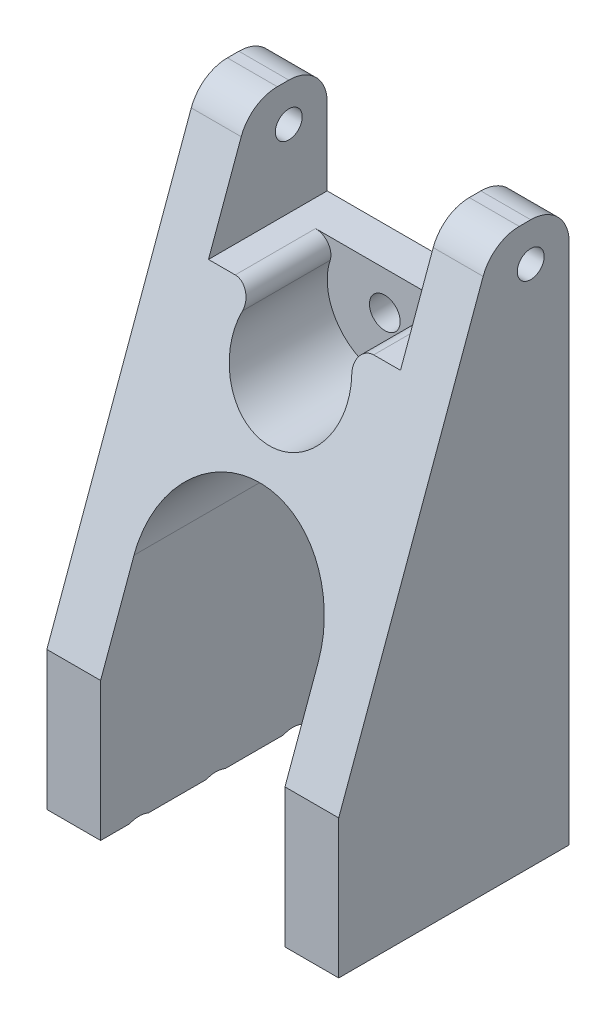
from build123d import *

# Parameters (mm, degrees)
BOSS_EXTRUDE1_DEPTH = 30
SKETCH2_R           = 2.25
CUT_EXTRUDE1_DEPTH  = 15
FILLET1_R           = 5
CHAMFER1_SIZE       = 20
CHAMFER1_SIZE_2     = 54.949548389
SKETCH3_W           = 25
SKETCH3_H           = 39.596952294
CUT_EXTRUDE2_DEPTH  = 15
SKETCH4_R           = 1.75
CUT_EXTRUDE3_DEPTH  = 65.75337829
CHAMFER2_SIZE       = 1
SKETCH5_R           = 2
CUT_EXTRUDE4_DEPTH  = 56.767373974
SKETCH6_R           = 7.5
CUT_EXTRUDE5_DEPTH  = 25
FILLET2_R           = 2
FILLET3_R           = 5


with BuildPart() as part:
    # Sketch1 → Boss-Extrude1 (new body)
    with BuildSketch(Plane.XY):
        with BuildLine():
            Line((-12, 0), (-12, -30))
            Line((-12, -30), (-19, -30))
            Line((-19, -30), (-19, 43))
            Line((-19, 43), (19, 43))
            Line((19, 43), (19, -30))
            Line((19, -30), (12, -30))
            Line((12, -30), (12, 0))
            ThreePointArc((12, 0), (0, 12), (-12, 0))
        make_face()
    extrude(amount=BOSS_EXTRUDE1_DEPTH)

    # Sketch2 → Cut-Extrude1 (cut)
    with BuildSketch(Plane.XZ.offset(30)):
        with Locations(Location((-15, 5, 0), (0, 0, 270))):
            Circle(SKETCH2_R)
        with Locations(Location((15, 5, 0), (0, 0, 270))):
            Circle(SKETCH2_R)
        with Locations(Location((-15, 15, 0), (0, 0, 270))):
            Circle(SKETCH2_R)
        with Locations(Location((15, 15, 0), (0, 0, 270))):
            Circle(SKETCH2_R)
        with Locations(Location((-15, 25, 0), (0, 0, 270))):
            Circle(SKETCH2_R)
        with Locations(Location((15, 25, 0), (0, 0, 270))):
            Circle(SKETCH2_R)
    extrude(amount=-CUT_EXTRUDE1_DEPTH, mode=Mode.SUBTRACT)

    # Fillet1
    fillet1_edges = [part.edges().sort_by_distance(p)[0] for p in [
        (0, 43, 0),
    ]]
    fillet(fillet1_edges, radius=FILLET1_R)

    # Chamfer1
    # the kernel refuses this chamfer: 54.949548389, 20 mm, written as the material it takes off along each edge
    with BuildSketch(Plane(origin=(-161.549828987, 43, 30), x_dir=(0, 0.09904090225205052, -0.9950833631817486), z_dir=(1, 0, 0))) as chamfer1_piece_1:
        Polygon((CHAMFER1_SIZE * 0.995083363182, -CHAMFER1_SIZE * 0.0990409022521), (-CHAMFER1_SIZE_2 * 0.0990409022522, -CHAMFER1_SIZE_2 * 0.995083363183), (0, 0), align=None)
    extrude(amount=323.099657974, mode=Mode.SUBTRACT)

    # Sketch3 → Cut-Extrude2 (cut)
    with BuildSketch(Plane(origin=(0, 43, 0), x_dir=(1, 0, 0), z_dir=(0, 1, 0))):
        Rectangle(SKETCH3_W, SKETCH3_H)
    extrude(amount=-CUT_EXTRUDE2_DEPTH, mode=Mode.SUBTRACT)

    # Sketch4 → Cut-Extrude3 (cut, through all)
    with BuildSketch(Plane.ZY.offset(19)):
        with Locations((5, 38)):
            Circle(SKETCH4_R)
    extrude(amount=-CUT_EXTRUDE3_DEPTH, mode=Mode.SUBTRACT)

    # Chamfer2
    # the kernel refuses this chamfer: 1 mm, written as the material it takes off along each edge
    with BuildSketch(Plane(origin=(-15, -30, 25), x_dir=(0, 0, -1), z_dir=(-1, 0, 0))) as chamfer2_piece_1:
        Polygon((2.25 + CHAMFER2_SIZE, 0), (2.25, -CHAMFER2_SIZE), (2.25, 0), align=None)
    revolve(axis=Axis((-15, -30, 25), (0, -1, 0)), mode=Mode.SUBTRACT)
    with BuildSketch(Plane(origin=(15, -30, 15), x_dir=(0, 0, -1), z_dir=(-1, 0, 0))) as chamfer2_piece_2:
        Polygon((2.25 + CHAMFER2_SIZE, 0), (2.25, -CHAMFER2_SIZE), (2.25, 0), align=None)
    revolve(axis=Axis((15, -30, 15), (0, -1, 0)), mode=Mode.SUBTRACT)
    with BuildSketch(Plane(origin=(-15, -30, 15), x_dir=(0, 0, -1), z_dir=(-1, 0, 0))) as chamfer2_piece_3:
        Polygon((2.25 + CHAMFER2_SIZE, 0), (2.25, -CHAMFER2_SIZE), (2.25, 0), align=None)
    revolve(axis=Axis((-15, -30, 15), (0, -1, 0)), mode=Mode.SUBTRACT)
    with BuildSketch(Plane(origin=(15, -30, 5), x_dir=(0, 0, -1), z_dir=(-1, 0, 0))) as chamfer2_piece_4:
        Polygon((2.25 + CHAMFER2_SIZE, 0), (2.25, -CHAMFER2_SIZE), (2.25, 0), align=None)
    revolve(axis=Axis((15, -30, 5), (0, -1, 0)), mode=Mode.SUBTRACT)
    with BuildSketch(Plane(origin=(15, -30, 25), x_dir=(0, 0, -1), z_dir=(-1, 0, 0))) as chamfer2_piece_5:
        Polygon((2.25 + CHAMFER2_SIZE, 0), (2.25, -CHAMFER2_SIZE), (2.25, 0), align=None)
    revolve(axis=Axis((15, -30, 25), (0, -1, 0)), mode=Mode.SUBTRACT)
    with BuildSketch(Plane(origin=(-15, -30, 5), x_dir=(0, 0, -1), z_dir=(-1, 0, 0))) as chamfer2_piece_6:
        Polygon((2.25 + CHAMFER2_SIZE, 0), (2.25, -CHAMFER2_SIZE), (2.25, 0), align=None)
    revolve(axis=Axis((-15, -30, 5), (0, -1, 0)), mode=Mode.SUBTRACT)

    # Sketch5 → Cut-Extrude4 (cut, through all)
    with BuildSketch(Plane(origin=(0, 0, 0), x_dir=(-1, 0, 0), z_dir=(0, 0, -1))):
        with Locations((0, 23)):
            Circle(SKETCH5_R)
    extrude(amount=-CUT_EXTRUDE4_DEPTH, mode=Mode.SUBTRACT)

    # Sketch6 → Cut-Extrude5 (cut)
    with BuildSketch(Plane.XY.offset(30)):
        with Locations((0, 23)):
            Circle(SKETCH6_R)
    extrude(amount=-CUT_EXTRUDE5_DEPTH, mode=Mode.SUBTRACT)

    # Fillet2
    fillet2_edges = [part.edges().sort_by_distance(p)[0] for p in [
        (-5.590169944, 28, 10.229776757),
        (5.590169944, 28, 10.229776757),
    ]]
    fillet(fillet2_edges, radius=FILLET2_R)

    # Fillet3
    fillet3_edges = [part.edges().sort_by_distance(p)[0] for p in [
        (-15.75, 43, 10),
        (15.75, 43, 10),
    ]]
    fillet(fillet3_edges, radius=FILLET3_R)


solid = part.part
